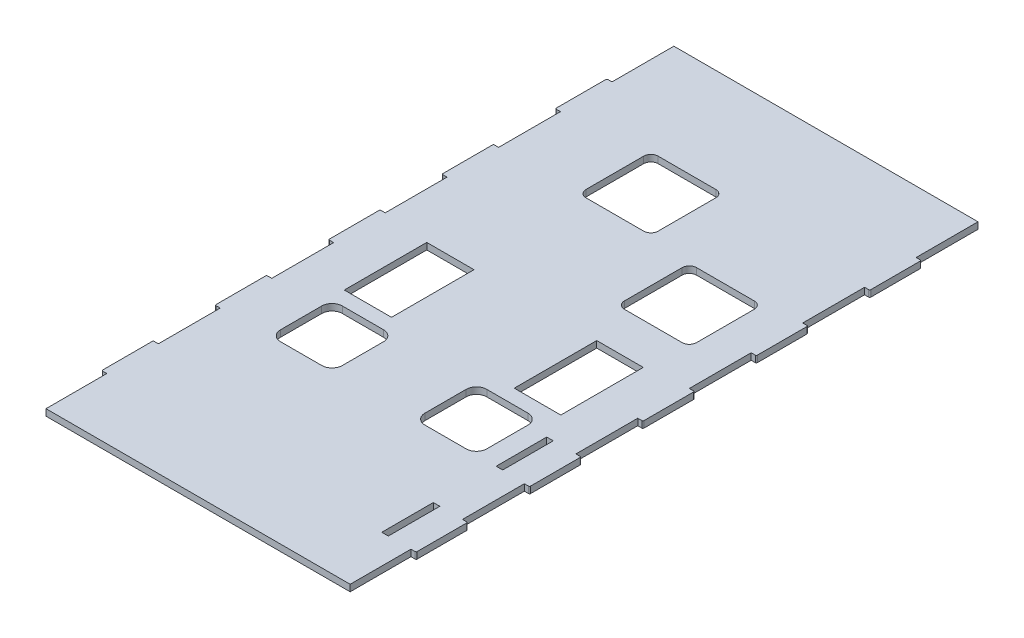
from build123d import *

# Parameters (mm, degrees)
SKETCH1_W           = 6.35
SKETCH1_H           = 50
SKETCH1_H_2         = 49
SKETCH1_W_2         = 45.825573982
SKETCH1_H_3         = 80
SKETCH1_W_3         = 45.139685757
BOSS_EXTRUDE1_DEPTH = 6.35
FILLET1_R           = 1


with BuildPart() as part:
    # Sketch1 → Boss-Extrude1 (new body)
    with BuildSketch(Plane(origin=(0, 0, 0), x_dir=(1, 0, 0), z_dir=(0, 1, 0))):
        Polygon((157.073624904, 348.621301775), (157.073624902, 288.621301775), (162.073624902, 288.621300264), (162.085917882, 238.621301775), (157.085917882, 238.621301775), (157.085917882, 178.621301775), (162.085917882, 178.621301775), (162.085917882, 128.621301775), (157.085917882, 128.621301775), (157.085917882, 68.621301775), (162.085917882, 68.621301775), (162.085917882, 18.621301775), (157.085917882, 18.621301775), (157.085917882, -41.378698225), (162.085917882, -41.378698225), (162.085917882, -91.378698225), (157.085917882, -91.378698225), (157.085917882, -151.378698225), (162.085917882, -151.378698225), (162.085917882, -201.378698225), (157.085917882, -201.378698225), (157.085917882, -260.378698225), (-137.926375098, -260.378698225), (-137.926375098, -201.378698225), (-142.938668078, -201.378698225), (-142.938668078, -151.378698225), (-137.926375098, -151.378698225), (-137.926375098, -91.378698225), (-142.926375098, -91.378698225), (-142.926375098, -41.378698225), (-137.926375098, -41.378698225), (-137.926375098, 18.621301775), (-142.938668078, 18.621301775), (-142.938668078, 68.621301775), (-137.926375098, 68.621301775), (-137.926375098, 128.621301775), (-142.938668078, 128.621301775), (-142.938668078, 178.621301775), (-137.926375098, 178.621301775), (-137.926375098, 238.621301775), (-142.938668078, 238.621301775), (-142.938668078, 288.621301775), (-137.926375096, 288.621301775), (-137.926375096, 348.621301775), align=None)
        with BuildLine():
            Line((-80.468838102, -30.378698225), (-40.468838102, -30.378698225))
            ThreePointArc((-40.468838102, -30.378698225), (-33.39777029, -33.307630413), (-30.468838102, -40.378698225))
            Line((-30.468838102, -40.378698225), (-30.468838102, -80.378698225))
            ThreePointArc((-30.468838102, -80.378698225), (-33.39777029, -87.449766037), (-40.468838102, -90.378698225))
            Line((-40.468838102, -90.378698225), (-80.468838102, -90.378698225))
            ThreePointArc((-80.468838102, -90.378698225), (-87.539905914, -87.449766037), (-90.468838102, -80.378698225))
            Line((-90.468838102, -80.378698225), (-90.468838102, -40.378698225))
            ThreePointArc((-90.468838102, -40.378698225), (-87.539905914, -33.307630413), (-80.468838102, -30.378698225))
        make_face(mode=Mode.SUBTRACT)
        with BuildLine():
            Line((59.585917882, -30.378698225), (99.585917882, -30.378698225))
            ThreePointArc((99.585917882, -30.378698225), (106.656985694, -33.307630413), (109.585917882, -40.378698225))
            Line((109.585917882, -40.378698225), (109.585917882, -80.378698225))
            ThreePointArc((109.585917882, -80.378698225), (106.656985694, -87.449766037), (99.585917882, -90.378698225))
            Line((99.585917882, -90.378698225), (59.585917882, -90.378698225))
            ThreePointArc((59.585917882, -90.378698225), (52.51485007, -87.449766037), (49.585917882, -80.378698225))
            Line((49.585917882, -80.378698225), (49.585917882, -40.378698225))
            ThreePointArc((49.585917882, -40.378698225), (52.51485007, -33.307630413), (59.585917882, -30.378698225))
        make_face(mode=Mode.SUBTRACT)
        with Locations((131.910917882, -176.378698225)):
            Rectangle(SKETCH1_W, SKETCH1_H, mode=Mode.SUBTRACT)
        with Locations((131.910917882, -65.878698225)):
            Rectangle(SKETCH1_W, SKETCH1_H_2, mode=Mode.SUBTRACT)
        with BuildLine():
            Line((-53.19802656, 248.621301775), (2.80197344, 248.621301775))
            ThreePointArc((2.80197344, 248.621301775), (7.751720908, 246.571049243), (9.80197344, 241.621301775))
            Line((9.80197344, 241.621301775), (9.80197344, 185.621301775))
            ThreePointArc((9.80197344, 185.621301775), (7.751720908, 180.671554307), (2.80197344, 178.621301775))
            Line((2.80197344, 178.621301775), (-53.198026561, 178.621301775))
            ThreePointArc((-53.198026561, 178.621301775), (-58.147774029, 180.671554307), (-60.198026561, 185.621301775))
            Line((-60.198026561, 185.621301775), (-60.19802656, 241.621301775))
            ThreePointArc((-60.19802656, 241.621301775), (-58.147774029, 246.571049243), (-53.19802656, 248.621301775))
        make_face(mode=Mode.SUBTRACT)
        with BuildLine():
            Line((59.085917882, 173.621301775), (115.085917882, 173.621301775))
            ThreePointArc((115.085917882, 173.621301775), (120.03566535, 171.571049243), (122.085917882, 166.621301775))
            Line((122.085917882, 166.621301775), (122.085917882, 110.621301775))
            ThreePointArc((122.085917882, 110.621301775), (120.03566535, 105.671554307), (115.085917882, 103.621301775))
            Line((115.085917882, 103.621301775), (59.085917882, 103.621301775))
            ThreePointArc((59.085917882, 103.621301775), (54.136170414, 105.671554307), (52.085917882, 110.621301775))
            Line((52.085917882, 110.621301775), (52.085917882, 166.621301775))
            ThreePointArc((52.085917882, 166.621301775), (54.136170414, 171.571049243), (59.085917882, 173.621301775))
        make_face(mode=Mode.SUBTRACT)
        with Locations((-70.013588107, 23.936670646)):
            Rectangle(SKETCH1_W_2, SKETCH1_H_3, mode=Mode.SUBTRACT)
        with Locations((94.516075004, 23.936670646)):
            Rectangle(SKETCH1_W_3, SKETCH1_H_3, mode=Mode.SUBTRACT)
    extrude(amount=BOSS_EXTRUDE1_DEPTH)

    # Fillet1
    fillet1_edges = [part.edges().sort_by_distance(p)[0] for p in [
        (-142.938668078, 3.175, -288.621301775),
        (-142.938668078, 3.175, -238.621301775),
        (-142.938668078, 3.175, -178.621301775),
        (-142.938668078, 3.175, -128.621301775),
        (-142.938668078, 3.175, -68.621301775),
        (-142.938668078, 3.175, -18.621301775),
        (-142.926375098, 3.175, 41.378698225),
        (-142.926375098, 3.175, 91.378698225),
        (-140.432521588, 0, 151.378698225),
        (-142.938668078, 3.175, 201.378698225),
        (162.073624902, 3.175, -288.621300264),
        (162.085917882, 3.175, -238.621301775),
        (162.085917882, 3.175, -178.621301775),
        (162.085917882, 3.175, -128.621301775),
        (162.085917882, 3.175, -68.621301775),
        (162.085917882, 3.175, -18.621301775),
        (162.085917882, 3.175, 41.378698225),
        (162.085917882, 3.175, 91.378698225),
        (162.085917882, 3.175, 151.378698225),
        (162.085917882, 3.175, 201.378698225),
    ]]
    fillet(fillet1_edges, radius=FILLET1_R)


solid = part.part
